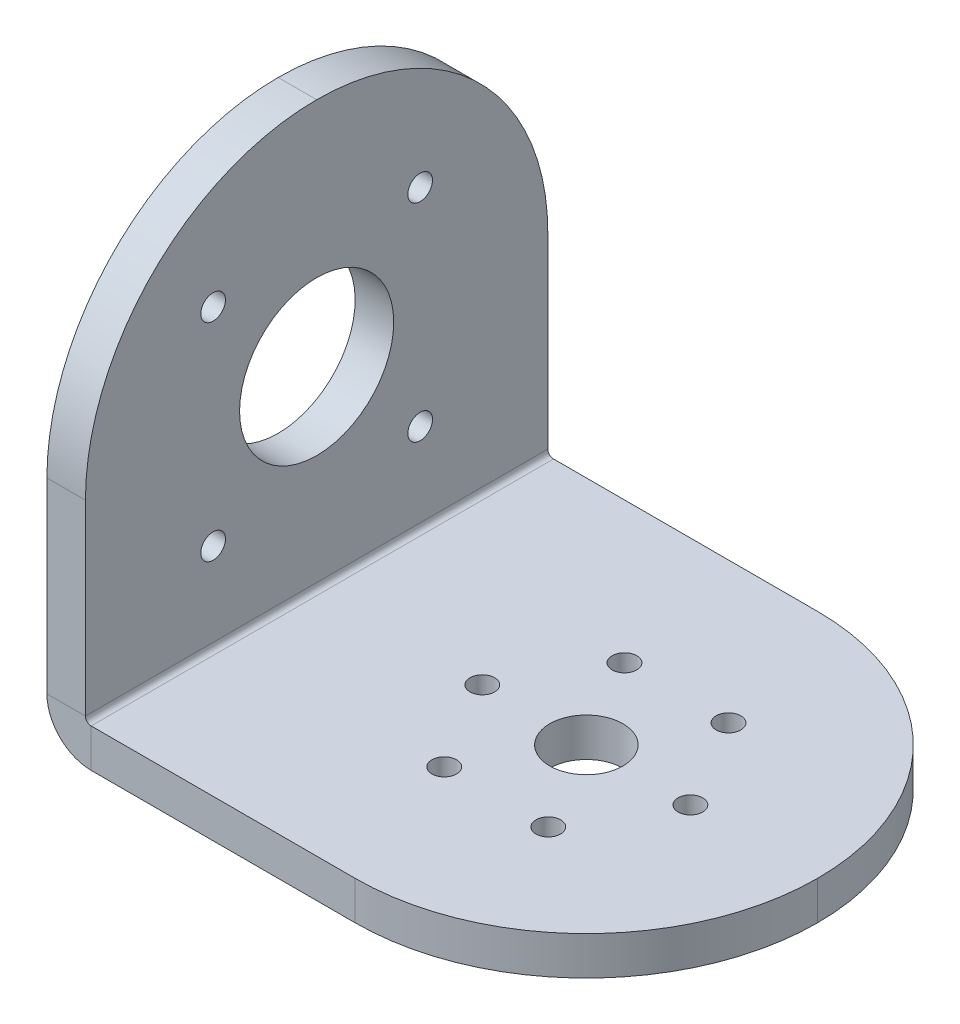
from build123d import *

# Parameters (mm, degrees)
SM_BASE_FLANGE_1_DEPTH  = 30
SKETCH_2_R              = 4.75
CUT_EXTRUDE_1_DEPTH     = 10
HOLE_WIZARD_1_OUTLINE_R = 1.6
HOLE_WIZARD_1_DEPTH     = 5
SKETCH_5_R              = 10
CUT_EXTRUDE_2_DEPTH     = 10
HOLE_WIZARD_2_OUTLINE_R = 1.6
HOLE_WIZARD_2_DEPTH     = 5
FILLET_1_R              = 30


# Read off the part's stored shape, not the designer's step: 孔1, 孔2
# Sheet-metal steps are written as plain solids
with BuildPart() as part:
    # Sketch 1 → 基体-法兰1 (new, symmetric)
    with BuildSketch(Plane.XY):
        with BuildLine():
            Line((70, 0), (5.7366, 0))
            ThreePointArc((5.7366, 0), (1.680211239, 1.680211239), (0, 5.7366))
            Line((0, 5.7366), (0, 60))
            Line((0, 60), (5, 60))
            Line((5, 60), (5, 5.7366))
            ThreePointArc((5, 5.7366), (5.215745145, 5.215745145), (5.7366, 5))
            Line((5.7366, 5), (70, 5))
            Line((70, 5), (70, 0))
        make_face()
    extrude(amount=SM_BASE_FLANGE_1_DEPTH, both=True)

    # Sketch 2 → 切除-拉伸1 (cut)
    with BuildSketch(Plane(origin=(0, 5, 0), x_dir=(1, 0, 0), z_dir=(0, 1, 0))):
        with Locations(Location((40, 0, 0), (0, 0, 180))):
            Circle(SKETCH_2_R)
    extrude(amount=-CUT_EXTRUDE_1_DEPTH, mode=Mode.SUBTRACT)

    # 孔1 outline → 孔1 (cut)
    with BuildSketch(Plane(origin=(0, 0, 0), x_dir=(1, 0, 0), z_dir=(0, 1, 0))):
        with Locations((33.25, -11.691342951)):
            Circle(HOLE_WIZARD_1_OUTLINE_R)
        with Locations((26.5, 0)):
            Circle(HOLE_WIZARD_1_OUTLINE_R)
        with Locations((33.25, 11.691342951)):
            Circle(HOLE_WIZARD_1_OUTLINE_R)
        with Locations((46.75, 11.691342951)):
            Circle(HOLE_WIZARD_1_OUTLINE_R)
        with Locations((53.5, 0)):
            Circle(HOLE_WIZARD_1_OUTLINE_R)
        with Locations((46.75, -11.691342951)):
            Circle(HOLE_WIZARD_1_OUTLINE_R)
    extrude(amount=HOLE_WIZARD_1_DEPTH, mode=Mode.SUBTRACT)

    # 草图5 → 切除-拉伸2 (cut)
    with BuildSketch(Plane.ZY):
        with Locations(Location((0, 30, 0), (0, 0, 270))):
            Circle(SKETCH_5_R)
    extrude(amount=-CUT_EXTRUDE_2_DEPTH, mode=Mode.SUBTRACT)

    # 孔2 outline → 孔2 (cut)
    with BuildSketch(Plane.YZ):
        with Locations((16.564971157, 13.435028843)):
            Circle(HOLE_WIZARD_2_OUTLINE_R)
        with Locations((16.564971157, -13.435028843)):
            Circle(HOLE_WIZARD_2_OUTLINE_R)
        with Locations((43.435028843, -13.435028843)):
            Circle(HOLE_WIZARD_2_OUTLINE_R)
        with Locations((43.435028843, 13.435028843)):
            Circle(HOLE_WIZARD_2_OUTLINE_R)
    extrude(amount=HOLE_WIZARD_2_DEPTH, mode=Mode.SUBTRACT)

    # 圆角1
    fillet_1_edges = [part.edges().sort_by_distance(p)[0] for p in [
        (70, 2.5, -30),
        (70, 2.5, 30),
        (2.5, 60, -30),
        (2.5, 60, 30),
    ]]
    fillet(fillet_1_edges, radius=FILLET_1_R - 0.0001)  # a hair under: the kernel refuses the full size


solid = part.part
